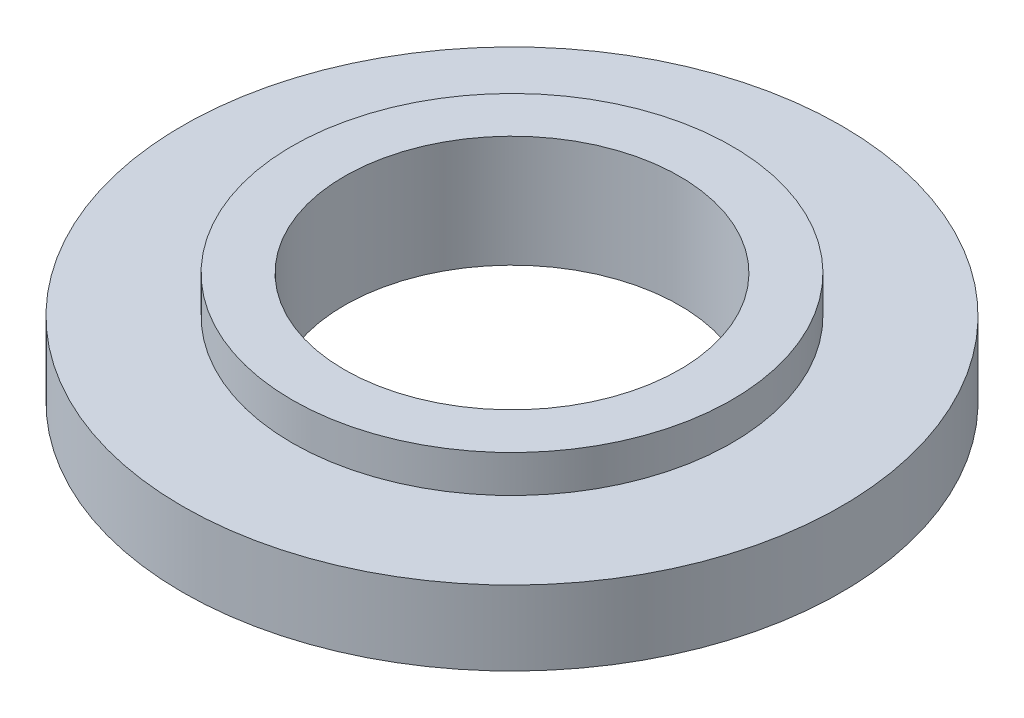
from build123d import *

# Parameters (mm, degrees)
SKETCH1_R           = 22.479
SKETCH1_R_2         = 11.43
BOSS_EXTRUDE1_DEPTH = 5.08
SKETCH2_R           = 14.9987
SKETCH2_R_2         = 11.43
BOSS_EXTRUDE2_DEPTH = 2.54


with BuildPart() as part:
    # Sketch1 → Boss-Extrude1 (new body)
    with BuildSketch(Plane(origin=(0, 0, 0), x_dir=(1, 0, 0), z_dir=(0, 1, 0))):
        Circle(SKETCH1_R)
        Circle(SKETCH1_R_2, mode=Mode.SUBTRACT)
    extrude(amount=BOSS_EXTRUDE1_DEPTH)

    # Sketch2 → Boss-Extrude2 (add)
    with BuildSketch(Plane(origin=(0, 5.08, 0), x_dir=(1, 0, 0), z_dir=(0, 1, 0))):
        Circle(SKETCH2_R)
        Circle(SKETCH2_R_2, mode=Mode.SUBTRACT)
    extrude(amount=BOSS_EXTRUDE2_DEPTH)


solid = part.part
